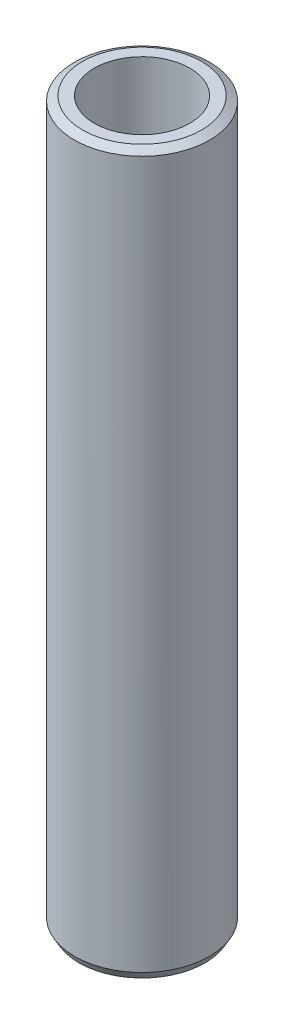
from build123d import *
from OCP.BRepFilletAPI import BRepFilletAPI_MakeChamfer

# Parameters (mm, degrees)
SKETCH1_R           = 40
BOSS_EXTRUDE1_DEPTH = 425.990256327
SKETCH2_R           = 28.306831025
CUT_EXTRUDE1_DEPTH  = 430.729797065
CHAMFER1_SIZE       = 2.766525308
CHAMFER1_SIZE2      = 4.791762394


with BuildPart() as part:
    # Sketch1 → Boss-Extrude1 (new body)
    with BuildSketch(Plane(origin=(0, 0, 0), x_dir=(1, 0, 0), z_dir=(0, 1, 0))):
        Circle(SKETCH1_R)
    extrude(amount=BOSS_EXTRUDE1_DEPTH)

    # Sketch2 → Cut-Extrude1 (cut, through all)
    with BuildSketch(Plane(origin=(0, 0, 0), x_dir=(1, 0, 0), z_dir=(0, 1, 0))):
        Circle(SKETCH2_R)
    extrude(amount=CUT_EXTRUDE1_DEPTH, mode=Mode.SUBTRACT)

    # Chamfer1: one chamfer whose edges measure the first distance from different faces: ONE call of the kernel's chamfer builder (chamfer() names one face for all edges)
    chamfer1_edges_1 = [part.edges().sort_by_distance(p)[0] for p in [
        (-40, 425.990256327, 0),
    ]]
    chamfer1_side_1 = [part.faces().sort_by_distance(p)[0] for p in [
        (-40, 212.995128164, 0),
    ]]
    chamfer1_edges_2 = [part.edges().sort_by_distance(p)[0] for p in [
        (-40, 0, 0),
    ]]
    chamfer1_side_2 = [part.faces().sort_by_distance(p)[0] for p in [
        (-38.86862915, 0, 0),
    ]]
    chamfer1 = BRepFilletAPI_MakeChamfer(part.part.solid().wrapped)
    for e in chamfer1_edges_1:
        chamfer1.Add(CHAMFER1_SIZE, CHAMFER1_SIZE2, e.wrapped, chamfer1_side_1[0].wrapped)  # the first distance lies on this face
    for e in chamfer1_edges_2:
        chamfer1.Add(CHAMFER1_SIZE, CHAMFER1_SIZE2, e.wrapped, chamfer1_side_2[0].wrapped)  # the first distance lies on this face
    add(Compound.cast(chamfer1.Shape()), mode=Mode.REPLACE)


solid = part.part
